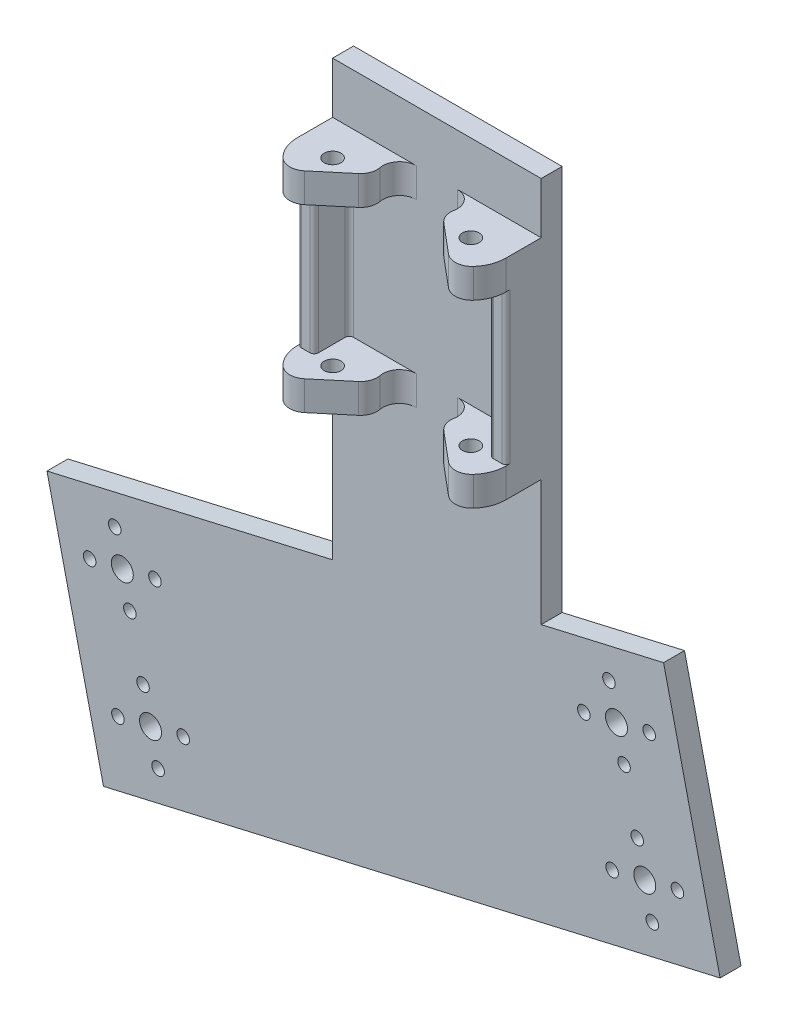
from build123d import *

# Parameters (mm, degrees)
BOSS_EXTRUDE2_DEPTH     = 7
CUT_EXTRUDE2_DEPTH      = 30.130224853
CUT_EXTRUDE2_DEPTH_BACK = 30.130224853
SKETCH3_R               = 2
BOSS_EXTRUDE3_DEPTH     = 36
SKETCH5_R               = 2
BOSS_EXTRUDE4_DEPTH     = 7
SKETCH13_W              = 49.8
SKETCH13_H              = 5
BOSS_EXTRUDE6_DEPTH     = 12.25
SKETCH15_W              = 49.8
SKETCH15_H              = 5
BOSS_EXTRUDE7_DEPTH     = 30
BOSS_EXTRUDE8_DEPTH     = 5
FILLET1_DEPTH           = 50
FILLET1_2_DEPTH         = 7
FILLET1_START           = 43
FILLET1_3_DEPTH         = 7
FILLET2_R               = 4
FILLET3_R               = 1
CUT_EXTRUDE3_DEPTH      = 150.305937317
CUT_EXTRUDE3_DEPTH_BACK = 150.305937317
SKETCH16_R              = 1.5
SKETCH16_R_2            = 2.625


with BuildPart() as part:
    # Sketch1 → Boss-Extrude2 (new body)
    with BuildSketch(Plane(origin=(0, 0, 0), x_dir=(1, 0, 0), z_dir=(0, 1, 0))):
        with BuildLine():
            Line((-24.9, 0), (-24.9, 13.4))
            Line((-24.9, 13.4), (24.9, 13.4))
            Line((24.9, 13.4), (24.9, 0))
            ThreePointArc((24.9, 0), (23.392904185, -4.800819919), (19.412411454, -7.878950407))
            Line((19.412411454, -7.878950407), (8.235013612, 1.5))
            ThreePointArc((8.235013612, 1.5), (11.116692467, 6.448255578), (16.5, 8.4))
            Line((16.5, 8.4), (-16.5, 8.4))
            ThreePointArc((-16.5, 8.4), (-11.116692467, 6.448255578), (-8.235013612, 1.5))
            Line((-8.235013612, 1.5), (-19.412411454, -7.878950407))
            ThreePointArc((-19.412411454, -7.878950407), (-23.392904185, -4.800819919), (-24.9, 0))
        make_face()
    extrude(amount=BOSS_EXTRUDE2_DEPTH)

    # Sketch3 → Cut-Extrude2 (cut, two sides: drawn at the far end of the back side and taken through both)
    with BuildSketch(Plane(origin=(0, 7, 0), x_dir=(1, 0, 0), z_dir=(0, 1, 0)).offset(-CUT_EXTRUDE2_DEPTH_BACK)):
        with Locations(Location((-16.5, 0, 0), (0, 0, 270))):
            Circle(SKETCH3_R)
        with Locations(Location((16.5, 0, 0), (0, 0, 270))):
            Circle(SKETCH3_R)
    extrude(amount=CUT_EXTRUDE2_DEPTH + CUT_EXTRUDE2_DEPTH_BACK, mode=Mode.SUBTRACT)

    # Sketch4 → Boss-Extrude3 (add)
    with BuildSketch(Plane(origin=(0, 7, 0), x_dir=(1, 0, 0), z_dir=(0, 1, 0))):
        Polygon((-24.9, 13.4), (-24.9, 0), (-20.9, 0), (-20.9, 8.4), (-16.5, 8.4), (16.5, 8.4), (20.9, 8.4), (20.9, 0), (24.9, 0), (24.9, 13.4), align=None)
    extrude(amount=BOSS_EXTRUDE3_DEPTH)

    # Sketch5 → Boss-Extrude4 (add)
    with BuildSketch(Plane(origin=(0, 43, 0), x_dir=(1, 0, 0), z_dir=(0, 1, 0))):
        with BuildLine():
            Line((-24.9, 13.4), (-24.9, 0))
            ThreePointArc((-24.9, 0), (-23.392904185, -4.800819919), (-19.412411454, -7.878950407))
            Line((-19.412411454, -7.878950407), (-8.235013612, 1.5))
            ThreePointArc((-8.235013612, 1.5), (-11.116692467, 6.448255578), (-16.5, 8.4))
            Line((-16.5, 8.4), (16.5, 8.4))
            ThreePointArc((16.5, 8.4), (11.116692467, 6.448255578), (8.235013612, 1.5))
            Line((8.235013612, 1.5), (19.412411454, -7.878950407))
            ThreePointArc((19.412411454, -7.878950407), (23.392904185, -4.800819919), (24.9, 0))
            Line((24.9, 0), (24.9, 13.4))
            Line((24.9, 13.4), (-24.9, 13.4))
        make_face()
        with Locations(Location((16.5, 0, 0), (0, 0, 270))):
            Circle(SKETCH5_R, mode=Mode.SUBTRACT)
        with Locations(Location((-16.5, 0, 0), (0, 0, 270))):
            Circle(SKETCH5_R, mode=Mode.SUBTRACT)
    extrude(amount=BOSS_EXTRUDE4_DEPTH)

    # Sketch13 → Boss-Extrude6 (add)
    with BuildSketch(Plane(origin=(0, 50, 0), x_dir=(1, 0, 0), z_dir=(0, 1, 0))):
        with Locations((0, 10.9)):
            Rectangle(SKETCH13_W, SKETCH13_H)
    extrude(amount=BOSS_EXTRUDE6_DEPTH)

    # Sketch15 → Boss-Extrude7 (add)
    with BuildSketch(Plane.XZ):
        with Locations((0, -10.9)):
            Rectangle(SKETCH15_W, SKETCH15_H)
    extrude(amount=BOSS_EXTRUDE7_DEPTH)

    # Sketch12 → Boss-Extrude8 (add)
    with BuildSketch(Plane(origin=(0, 0, -13.4), x_dir=(-1, 0, 0), z_dir=(0, 0, -1))):
        Polygon((24.9, -30), (24.9, -41.497235918), (93.105904535, -57.243809722), (79.608841274, -115.706013609), (-67.628165204, -81.713672257), (-54.131101944, -23.25146837), (-24.9, -30), align=None)
    extrude(amount=-BOSS_EXTRUDE8_DEPTH)

    # Fillet1: read off the stored shape, not the designer's step
    # Fillet1 outline → Fillet1 (cut)
    with BuildSketch(Plane(origin=(0, 0, 0), x_dir=(1, 0, 0), z_dir=(0, 1, 0))):
        with BuildLine():
            Line((-19.412411454, -7.878950407), (-17.191978394, -6.015785846))
            ThreePointArc((-17.191978394, -6.015785846), (-20.037614317, -6.942179175), (-22.729609591, -5.63488814))
            ThreePointArc((-22.729609591, -5.63488814), (-21.206707029, -6.957507379), (-19.412411454, -7.878950407))
        make_face()
        with BuildLine():
            ThreePointArc((22.729609591, -5.63488814), (20.037614317, -6.942179175), (17.191978394, -6.015785846))
            Line((17.191978394, -6.015785846), (19.412411454, -7.878950407))
            ThreePointArc((19.412411454, -7.878950407), (21.206707029, -6.957507379), (22.729609591, -5.63488814))
        make_face()
    extrude(amount=FILLET1_DEPTH, mode=Mode.SUBTRACT)

    # Fillet1 2 outline → Fillet1 2 (add)
    with BuildSketch(Plane(origin=(0, 0, 0), x_dir=(1, 0, 0), z_dir=(0, 1, 0))):
        with BuildLine():
            Line((16.5, 8.4), (4.906898603, 8.4))
            ThreePointArc((4.906898603, 8.4), (8.19911817, 6.671847337), (8.646608731, 2.980645161))
            ThreePointArc((8.646608731, 2.980645161), (11.729120592, 6.91366109), (16.5, 8.4))
        make_face()
        with BuildLine():
            ThreePointArc((-16.5, 8.4), (-11.729120592, 6.91366109), (-8.646608731, 2.980645161))
            ThreePointArc((-8.646608731, 2.980645161), (-8.19911817, 6.671847337), (-4.906898603, 8.4))
            Line((-4.906898603, 8.4), (-16.5, 8.4))
        make_face()
    extrude(amount=FILLET1_2_DEPTH)

    # Fillet1 3 outline → Fillet1 3 (add)
    with BuildSketch(Plane(origin=(0, 0, 0), x_dir=(1, 0, 0), z_dir=(0, 1, 0)).offset(FILLET1_START)):
        with BuildLine():
            Line((16.5, 8.4), (4.906898603, 8.4))
            ThreePointArc((4.906898603, 8.4), (8.19911817, 6.671847337), (8.646608731, 2.980645161))
            ThreePointArc((8.646608731, 2.980645161), (11.729120592, 6.91366109), (16.5, 8.4))
        make_face()
        with BuildLine():
            ThreePointArc((-16.5, 8.4), (-11.729120592, 6.91366109), (-8.646608731, 2.980645161))
            ThreePointArc((-8.646608731, 2.980645161), (-8.19911817, 6.671847337), (-4.906898603, 8.4))
            Line((-4.906898603, 8.4), (-16.5, 8.4))
        make_face()
    extrude(amount=FILLET1_3_DEPTH)

    # Fillet2
    fillet2_edges = [part.edges().sort_by_distance(p)[0] for p in [
        (-8.235013612, 3.5, -1.5),
        (8.235013612, 3.5, -1.5),
        (8.235013612, 46.5, -1.5),
        (-8.235013612, 46.5, -1.5),
    ]]
    fillet(fillet2_edges, radius=FILLET2_R)

    # Fillet3
    fillet3_edges = [part.edges().sort_by_distance(p)[0] for p in [
        (-24.9, 25, 0),
        (-20.9, 25, 0),
        (-20.9, 25, -8.4),
        (20.9, 25, -8.4),
        (20.9, 25, 0),
        (24.9, 25, 0),
    ]]
    fillet(fillet3_edges, radius=FILLET3_R)

    # Sketch16 → Cut-Extrude3 (cut, two sides: drawn at the far end of the back side and taken through both)
    with BuildSketch(Plane.XY.offset(-8.4).offset(-CUT_EXTRUDE3_DEPTH_BACK)):
        with Locations((50.684777305, -39.441676722)):
            Circle(SKETCH16_R)
        with Locations((42.889816787, -41.241285157)):
            Circle(SKETCH16_R_2)
        with Locations((44.689425222, -49.036245675)):
            Circle(SKETCH16_R)
        with Locations((35.094856269, -43.040893591)):
            Circle(SKETCH16_R)
        with Locations((41.090208352, -33.446324638)):
            Circle(SKETCH16_R)
        with Locations((-82.911048266, -70.284703313)):
            Circle(SKETCH16_R)
        with Locations((-76.915696183, -60.69013436)):
            Circle(SKETCH16_R)
        with Locations((-67.32112723, -66.685486444)):
            Circle(SKETCH16_R)
        with Locations((-73.316479313, -76.280055397)):
            Circle(SKETCH16_R)
        with Locations((-75.116087748, -68.485094879)):
            Circle(SKETCH16_R_2)
        with Locations(Location((47.838739983, -62.677426582, 0), (0, 0, 180))):
            Circle(SKETCH16_R)
        with Locations(Location((57.433308936, -68.672778665, 0), (0, 0, 180))):
            Circle(SKETCH16_R)
        with Locations(Location((41.843387899, -72.271995535, 0), (0, 0, 180))):
            Circle(SKETCH16_R)
        with Locations(Location((49.638348417, -70.4723871, 0), (0, 0, 180))):
            Circle(SKETCH16_R_2)
        with Locations(Location((51.437956852, -78.267347618, 0), (0, 0, 180))):
            Circle(SKETCH16_R)
        with Locations(Location((-76.162516636, -99.515805257, 0), (0, 0, 180))):
            Circle(SKETCH16_R)
        with Locations(Location((-66.567947683, -105.511157341, 0), (0, 0, 180))):
            Circle(SKETCH16_R)
        with Locations(Location((-60.572595599, -95.916588388, 0), (0, 0, 180))):
            Circle(SKETCH16_R)
        with Locations(Location((-68.367556118, -97.716196822, 0), (0, 0, 180))):
            Circle(SKETCH16_R_2)
        with Locations(Location((-70.167164552, -89.921236304, 0), (0, 0, 180))):
            Circle(SKETCH16_R)
    extrude(amount=CUT_EXTRUDE3_DEPTH + CUT_EXTRUDE3_DEPTH_BACK, mode=Mode.SUBTRACT)


solid = part.part
